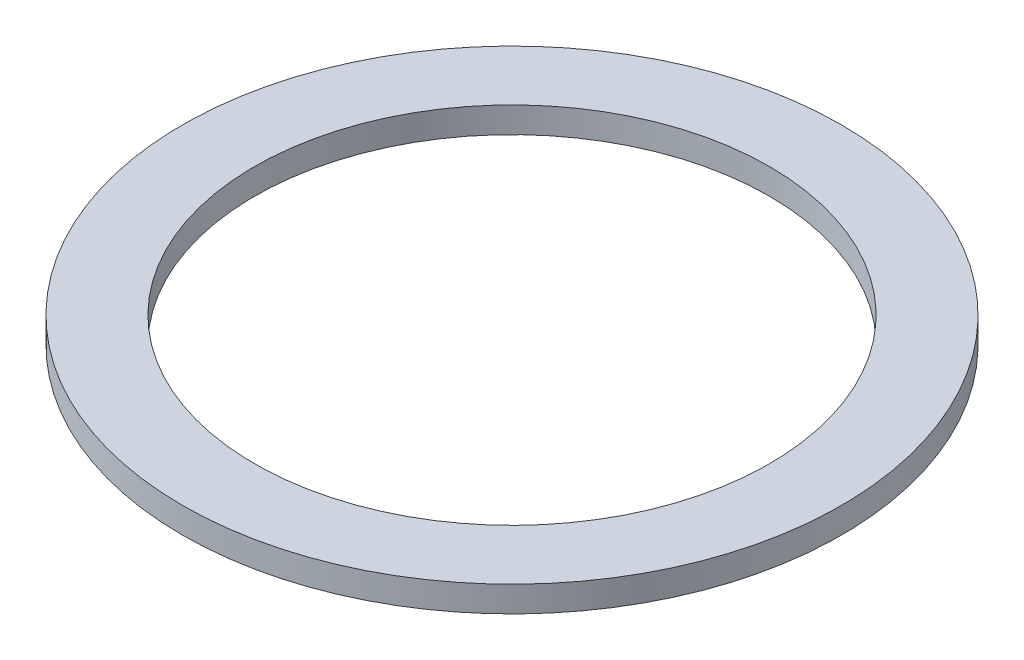
from build123d import *

# Parameters (mm, degrees)
SZKIC1_W = 14
SZKIC1_H = 5


with BuildPart() as part:
    # Szkic1 → Obrót1 (revolve)
    with BuildSketch(Plane.XY):
        with Locations((-57, 2.5)):
            Rectangle(SZKIC1_W, SZKIC1_H)
    revolve(axis=Axis((0, 0, 0), (0, 1, 0)))


solid = part.part
